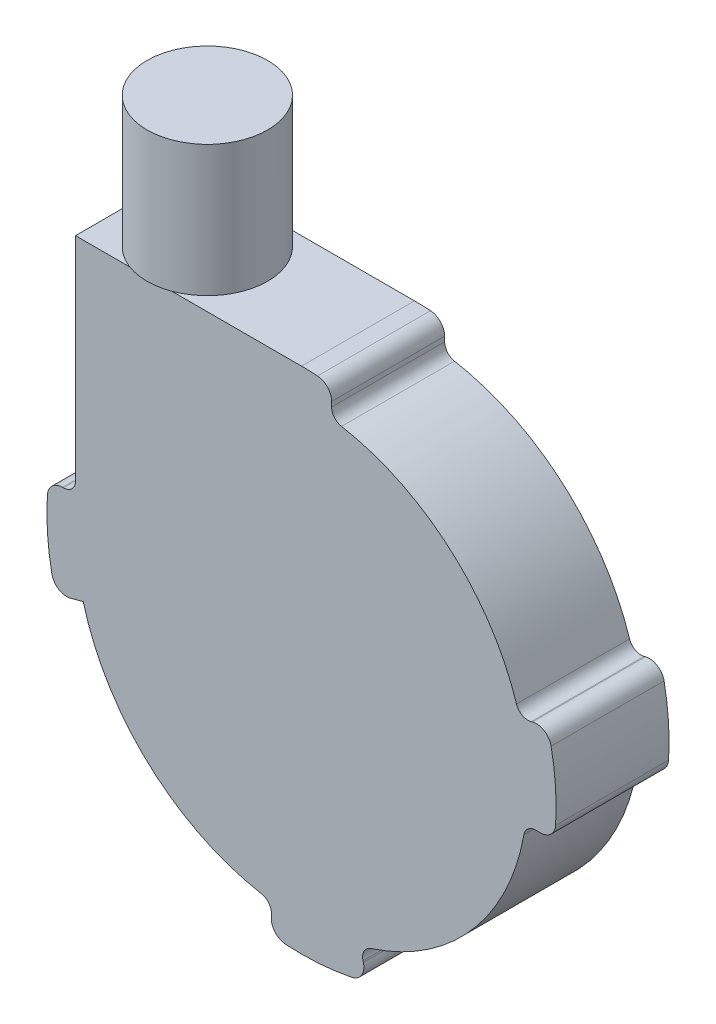
from build123d import *

# Parameters (mm, degrees)
BOSS_EXTRUDE1_DEPTH = 19.05
SKETCH3_R           = 10.16
BOSS_EXTRUDE2_DEPTH = 22.098


with BuildPart() as part:
    # Sketch1 → Boss-Extrude1 (new body)
    with BuildSketch(Plane.XY):
        with BuildLine():
            Line((0, 42.926), (-38.1, 42.926))
            Line((-38.1, 42.926), (-38.1, 7.112))
            ThreePointArc((-38.1, 7.112), (-38.695159021, 5.675159021), (-40.132, 5.08))
            Line((-40.132, 5.08), (-40.306046643, 5.08))
            ThreePointArc((-40.306046643, 5.08), (-42.044701151, 4.391669653), (-42.84101813, 2.699748428))
            ThreePointArc((-42.84101813, 2.699748428), (-42.826895163, -2.915223262), (-42.079992146, -8.480314673))
            ThreePointArc((-42.079992146, -8.480314673), (-40.928630423, -10.137179569), (-38.932651408, -10.431972504))
            Line((-38.932651408, -10.431972504), (-36.801773982, -9.861005618))
            ThreePointArc((-36.801773982, -9.861005618), (-25.790833033, -28.043589846), (-6.751898734, -37.496958056))
            ThreePointArc((-6.751898734, -37.496958056), (-5.553034033, -38.193473482), (-5.08, -39.496795819))
            Line((-5.08, -39.496795819), (-5.08, -40.306046643))
            ThreePointArc((-5.08, -40.306046643), (-4.391669653, -42.044701151), (-2.699748428, -42.84101813))
            ThreePointArc((-2.699748428, -42.84101813), (2.915223262, -42.826895163), (8.480314673, -42.079992146))
            ThreePointArc((8.480314673, -42.079992146), (10.137179569, -40.928630423), (10.431972504, -38.932651408))
            Line((10.431972504, -38.932651408), (10.373602936, -38.714813213))
            ThreePointArc((10.373602936, -38.714813213), (10.551435212, -37.217784034), (11.711738178, -36.255278083))
            ThreePointArc((11.711738178, -36.255278083), (28.687737703, -25.072369363), (37.496958056, -6.751898734))
            ThreePointArc((37.496958056, -6.751898734), (38.193473482, -5.553034033), (39.496795819, -5.08))
            Line((39.496795819, -5.08), (40.306046643, -5.08))
            ThreePointArc((40.306046643, -5.08), (42.044701151, -4.391669653), (42.84101813, -2.699748428))
            ThreePointArc((42.84101813, -2.699748428), (42.826895163, 2.915223262), (42.079992146, 8.480314673))
            ThreePointArc((42.079992146, 8.480314673), (40.928630423, 10.137179569), (38.932651408, 10.431972504))
            Line((38.932651408, 10.431972504), (38.714813213, 10.373602936))
            ThreePointArc((38.714813213, 10.373602936), (37.217784034, 10.551435212), (36.255278083, 11.711738178))
            ThreePointArc((36.255278083, 11.711738178), (25.072369363, 28.687737703), (6.751898734, 37.496958056))
            ThreePointArc((6.751898734, 37.496958056), (5.553034033, 38.193473482), (5.08, 39.496795819))
            Line((5.08, 39.496795819), (5.08, 40.306046643))
            ThreePointArc((5.08, 40.306046643), (4.391669653, 42.044701151), (2.699748428, 42.84101813))
            ThreePointArc((2.699748428, 42.84101813), (1.350542807, 42.904749272), (0, 42.926))
        make_face()
    extrude(amount=-BOSS_EXTRUDE1_DEPTH)

    # Sketch3 → Boss-Extrude2 (add)
    with BuildSketch(Plane(origin=(0, 42.926, 0), x_dir=(1, 0, 0), z_dir=(0, 1, 0))):
        with Locations((-25.4, 9.525)):
            Circle(SKETCH3_R)
    extrude(amount=BOSS_EXTRUDE2_DEPTH)


solid = part.part
